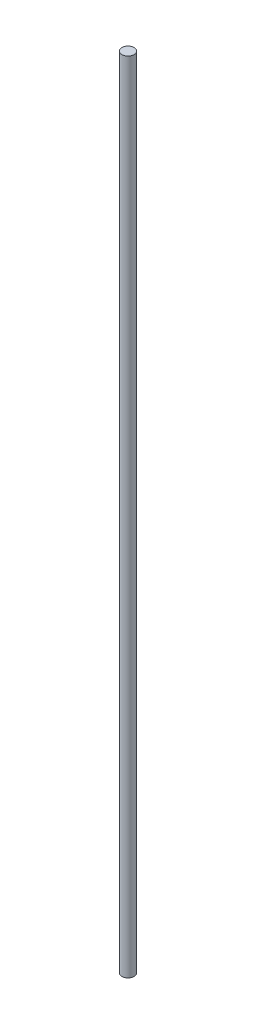
from build123d import *

# Parameters (mm, degrees)
SKETCH1_R           = 1
BOSS_EXTRUDE1_DEPTH = 65


with BuildPart() as part:
    # Sketch1 → Boss-Extrude1 (new, symmetric)
    with BuildSketch(Plane(origin=(0, 0, 0), x_dir=(1, 0, 0), z_dir=(0, 1, 0))):
        Circle(SKETCH1_R)
    extrude(amount=BOSS_EXTRUDE1_DEPTH, both=True)


solid = part.part
